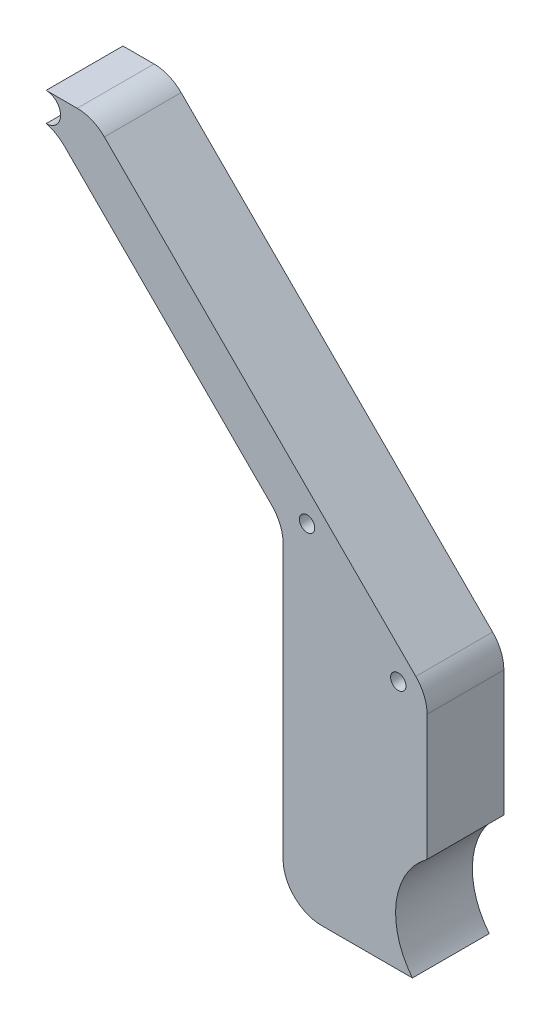
from build123d import *

# Parameters (mm, degrees)
EXTRUDE_618_DEPTH   = 8
HOLE_WIZARD_M2_D    = 1.6
SKETCH_5_W          = 15
SKETCH_5_H          = 23
EXTRUDE_1905_DEPTH  = 8
FILLET_1_R          = 4
CUT_EXTRUDE_1_DEPTH = 60.03470161


with BuildPart() as part:
    # Эскиз1 → Extrude 618 (new body)
    with BuildSketch(Plane.XY):
        with BuildLine():
            Line((0.03033425, 5), (-14.96966575, 5))
            Line((-14.96966575, 5), (-14.96966575, 16.141238626))
            Line((-14.96966575, 16.141238626), (-38.828427125, 40))
            Line((-38.828427125, 40), (-39.64966575, 40))
            ThreePointArc((-39.64966575, 40), (-38.14966575, 41.5), (-39.64966575, 43))
            Line((-39.64966575, 43), (-34.757359313, 43))
            Line((-34.757359313, 43), (0.03033425, 8.212306438))
            Line((0.03033425, 8.212306438), (0.03033425, 5))
        make_face()
    extrude(amount=-EXTRUDE_618_DEPTH)

    # Крепление M2 (through all)
    with Locations(Plane.XY):
        with Locations((-2.96966575, 8), (-12.46966575, 17.5)):
            Hole(HOLE_WIZARD_M2_D / 2)

    # Эскиз5 → Extrude 1905 (add)
    with BuildSketch(Plane.XY):
        with Locations((-7.46966575, -6.5)):
            Rectangle(SKETCH_5_W, SKETCH_5_H)
    extrude(amount=-EXTRUDE_1905_DEPTH)

    # Скругление1
    # the kernel refuses this fillet: 4 mm, written as the material it adds along each edge
    with BuildSketch(Plane(origin=(-38.828427125, 40, 0), x_dir=(-1.0, -1.0209461682873532e-12, 0), z_dir=(0, 0, -1))) as fillet_1_piece_1:
        with BuildLine():
            CenterArc((1.771325284, -3.885528966), FILLET_1_R, 103.740313028, 31.259686972)
            Line((-1.057101841, -1.057101841), (0, 0))
            Line((0, 0), (0.821238626, 0))
        make_face()
    extrude(amount=8)
    with BuildSketch(Plane(origin=(-14.96966575, 16.141238626, 0), x_dir=(-0.7071067811865497, 0.7071067811865454, 0), z_dir=(0, 0, -1))) as fillet_1_piece_2:
        with BuildLine():
            CenterArc((FILLET_1_R * 0.414213562373, -FILLET_1_R), FILLET_1_R, 90, 45)
            Line((-FILLET_1_R * 0.292893218813, -FILLET_1_R * 0.292893218813), (0, 0))
            Line((0, 0), (FILLET_1_R * 0.414213562373, 0))
        make_face()
    extrude(amount=8)
    # the kernel refuses this fillet: 4 mm, written as the material it takes off along each edge
    with BuildSketch(Plane(origin=(-34.757359313, 43, 4.142135624), x_dir=(0.7071067811865497, -0.7071067811865454, 0), z_dir=(0, 0, -1)), Plane(origin=(0.03033425, 8.212306438, 4.142135624), x_dir=(0, -1, 0), z_dir=(0, 0, -1))) as fillet_1_2_piece_1:
        with BuildLine():
            CenterArc((FILLET_1_R * 0.414213562373, FILLET_1_R), FILLET_1_R, 225, 45)
            Line((-FILLET_1_R * 0.292893218813, FILLET_1_R * 0.292893218813), (0, 0))
            Line((0, 0), (FILLET_1_R * 0.414213562373, 0))
        make_face()
    extrude(amount=16.284271247, mode=Mode.SUBTRACT)
    with BuildSketch(Plane(origin=(-14.96966575, -18, 10), x_dir=(1, 0, 0), z_dir=(0, 0, -1))) as fillet_1_2_piece_2:
        with BuildLine():
            CenterArc((FILLET_1_R, -FILLET_1_R), FILLET_1_R, 90, 90)
            Line((0, -FILLET_1_R), (0, 0))
            Line((0, 0), (FILLET_1_R, 0))
        make_face()
    extrude(amount=28, mode=Mode.SUBTRACT)

    # Эскиз6 → Вырез-Вытянуть1 (cut, through all)
    with BuildSketch(Plane.XY):
        with BuildLine():
            Line((0.03033425, -6.540529805), (0.03033425, -19.459470195))
            ThreePointArc((0.03033425, -19.459470195), (-3.25, -13), (0.03033425, -6.540529805))
        make_face()
    extrude(amount=-CUT_EXTRUDE_1_DEPTH, mode=Mode.SUBTRACT)


solid = part.part
